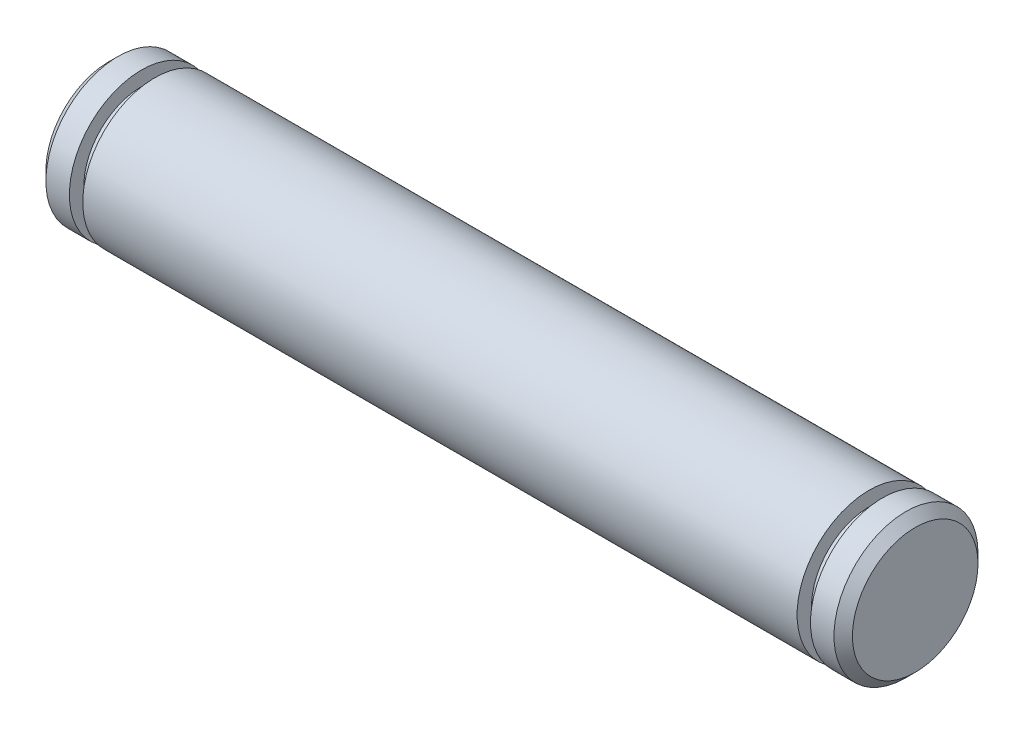
from build123d import *

# Parameters (mm, degrees)
SKETCH1_R           = 3.96875
BOSS_EXTRUDE1_DEPTH = 22.225
CHAMFER1_SIZE       = 0.508
CUT_EXTRUDE1_START  = 0.7366
SKETCH2_R           = 3.96875
SKETCH2_R_2         = 3.175
CUT_EXTRUDE1_DEPTH  = 0.7366


with BuildPart() as part:
    # Sketch1 → Boss-Extrude1 (new, symmetric)
    with BuildSketch(Plane(origin=(0, 0, 0), x_dir=(0, 0, -1), z_dir=(1, 0, 0))):
        Circle(SKETCH1_R)
    extrude(amount=BOSS_EXTRUDE1_DEPTH, both=True)

    # Chamfer1
    chamfer1_edges = [part.edges().sort_by_distance(p)[0] for p in [
        (-22.225, 0, 3.96875),
        (22.225, 0, 3.96875),
    ]]
    chamfer(chamfer1_edges, length=CHAMFER1_SIZE)

    # Sketch2 → Cut-Extrude1 (cut)
    with BuildSketch(Plane(origin=(19.685, 0, 0), x_dir=(0, 0, -1), z_dir=(1, 0, 0)).offset(CUT_EXTRUDE1_START)):
        Circle(SKETCH2_R)
        Circle(SKETCH2_R_2, mode=Mode.SUBTRACT)
    cut_extrude1 = extrude(amount=-CUT_EXTRUDE1_DEPTH, mode=Mode.SUBTRACT)

    # Mirror1: Cut-Extrude1 across plane
    add(cut_extrude1.mirror(Plane(origin=(0, 0, 0), x_dir=(0, 0, 1), z_dir=(1, 0, 0))), mode=Mode.SUBTRACT)


solid = part.part
